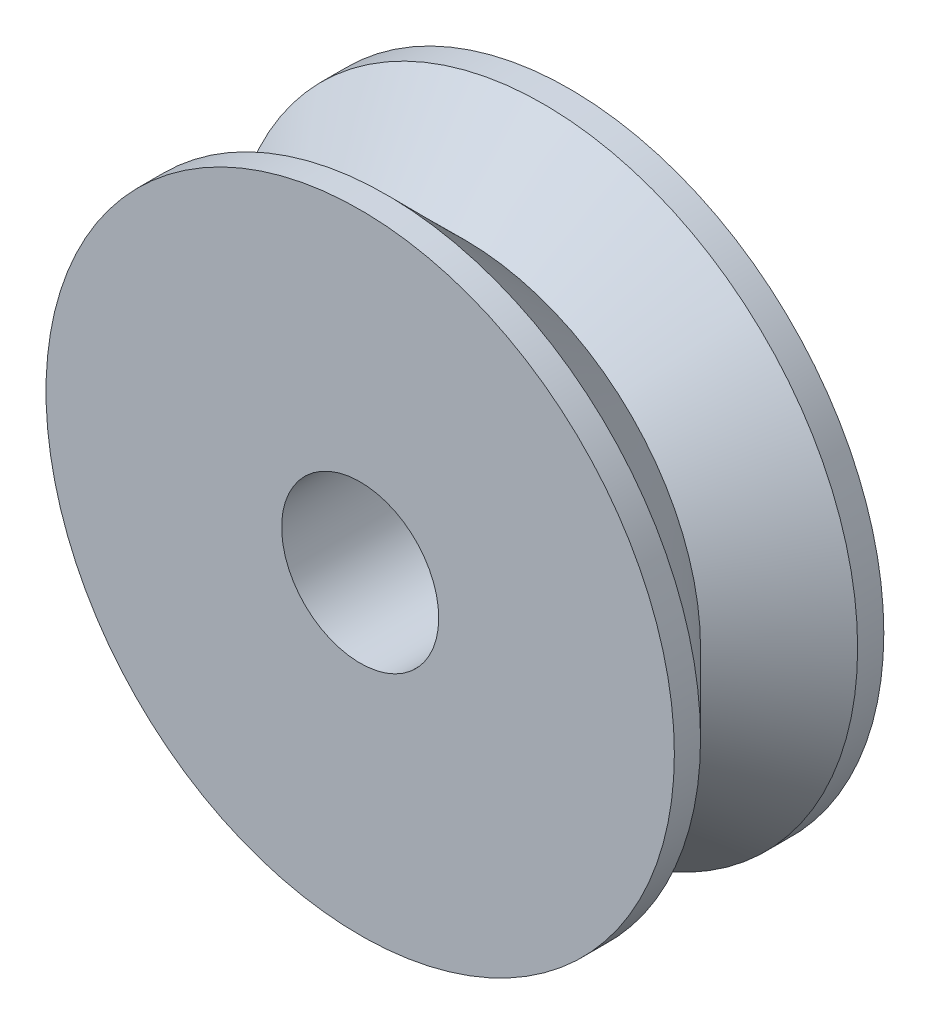
from build123d import *

# Parameters (mm, degrees)
SKETCH1_R           = 6
SKETCH1_R_2         = 1.5
BOSS_EXTRUDE1_DEPTH = 2
CHAMFER1_SIZE       = 1.5
SKETCH2_R           = 6
SKETCH2_R_2         = 1.5
BOSS_EXTRUDE2_DEPTH = 2
CHAMFER2_SIZE       = 1.5


with BuildPart() as part:
    # Sketch1 → Boss-Extrude1 (new body)
    with BuildSketch(Plane.XY):
        Circle(SKETCH1_R)
        Circle(SKETCH1_R_2, mode=Mode.SUBTRACT)
    extrude(amount=BOSS_EXTRUDE1_DEPTH)

    # Chamfer1
    chamfer1_edges = [part.edges().sort_by_distance(p)[0] for p in [
        (-6, 0, 2),
    ]]
    chamfer(chamfer1_edges, length=CHAMFER1_SIZE)

    # Sketch2 → Boss-Extrude2 (add)
    with BuildSketch(Plane.XY.offset(2)):
        Circle(SKETCH2_R)
        Circle(SKETCH2_R_2, mode=Mode.SUBTRACT)
    extrude(amount=BOSS_EXTRUDE2_DEPTH)

    # Chamfer2
    chamfer2_edges = [part.edges().sort_by_distance(p)[0] for p in [
        (-6, 0, 2),
    ]]
    chamfer(chamfer2_edges, length=CHAMFER2_SIZE - 0.0001)  # a hair under: the kernel refuses the full size


solid = part.part
